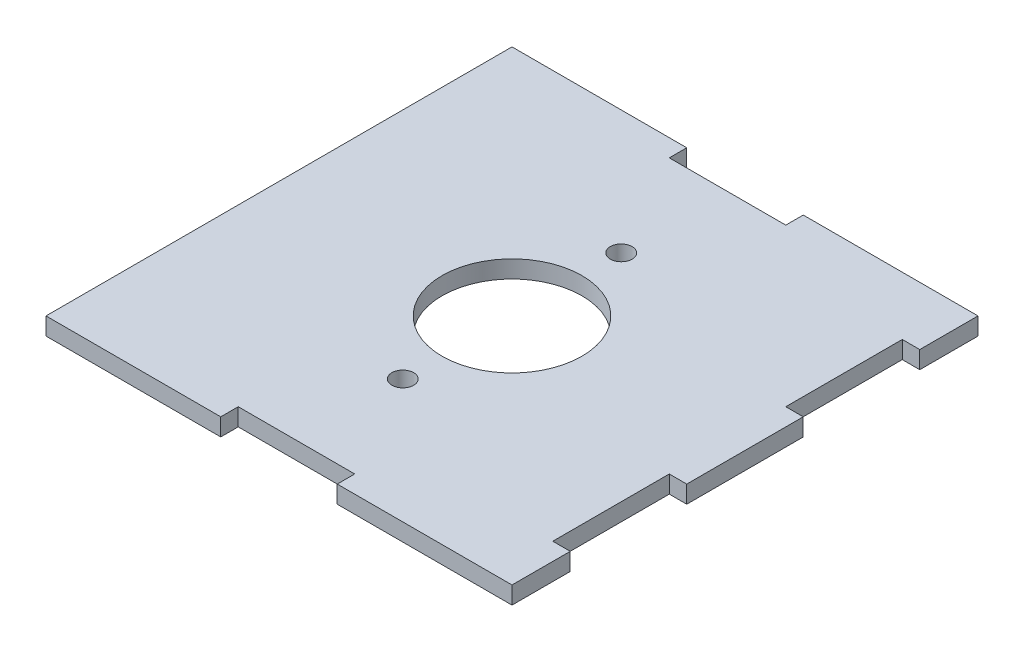
from build123d import *

# Parameters (mm, degrees)
CROQUIS1_R              = 12
CROQUIS1_R_2            = 1.875
SALIENTE_EXTRUIR1_DEPTH = 3


with BuildPart() as part:
    # Croquis1 → Saliente-Extruir1 (new body)
    with BuildSketch(Plane(origin=(0, 0, 0), x_dir=(1, 0, 0), z_dir=(0, 1, 0))):
        Polygon((-40, 40), (-10, 40), (-10, 37), (0, 37), (10, 37), (10, 40), (37, 40), (40, 40), (40, 30), (37, 30), (37, 10), (40, 10), (40, -10), (37, -10), (37, -30), (40, -30), (40, -40), (37, -40), (10, -40), (10, -37), (0, -37), (-10, -37), (-10, -40), (-40, -40), align=None)
        Circle(CROQUIS1_R, mode=Mode.SUBTRACT)
        with Locations((0, 18.75)):
            Circle(CROQUIS1_R_2, mode=Mode.SUBTRACT)
        with Locations((0, -18.75)):
            Circle(CROQUIS1_R_2, mode=Mode.SUBTRACT)
    extrude(amount=SALIENTE_EXTRUIR1_DEPTH)


solid = part.part
